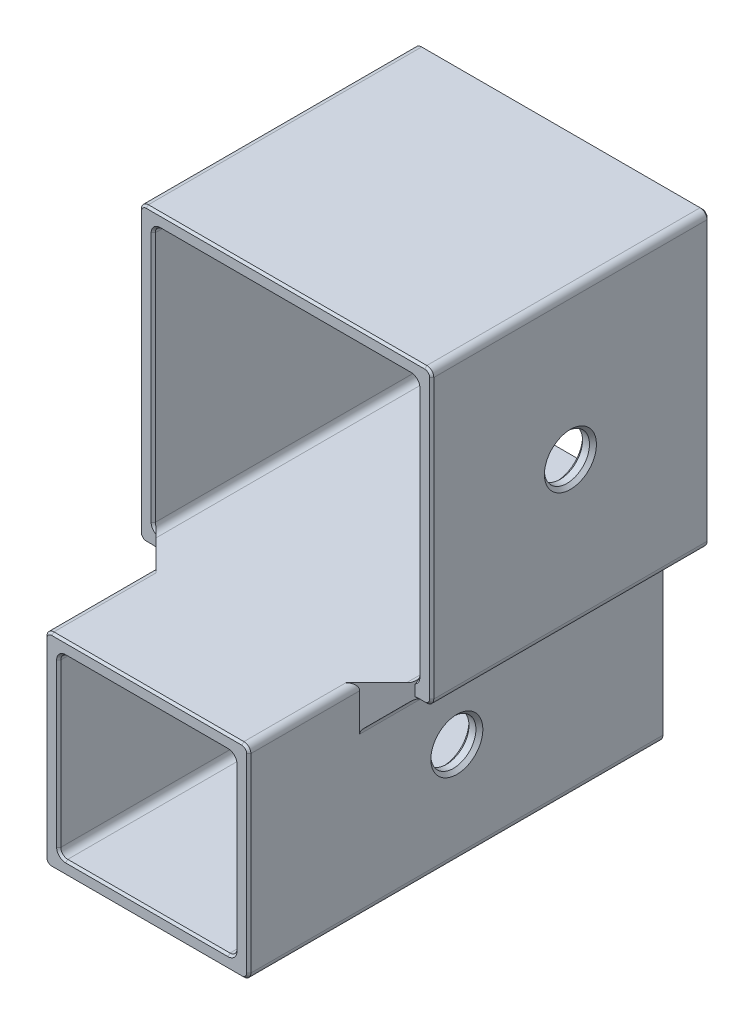
from build123d import *

# Parameters (mm, degrees)
SKETCH1_W           = 42.15
SKETCH1_H           = 42.15
SKETCH1_W_2         = 38.15
SKETCH1_H_2         = 38.15
BOSS_EXTRUDE1_DEPTH = 40
BOSS_EXTRUDE2_START = -40
SKETCH3_W           = 29.4
SKETCH3_H           = 29.4
SKETCH3_W_2         = 25.4
SKETCH3_H_2         = 25.4
BOSS_EXTRUDE2_DEPTH = 60
CHAMFER1_SIZE       = 4
FILLET1_R           = 1
CHAMFER2_SIZE       = 0.3
SKETCH6_R           = 3.25
CUT_EXTRUDE1_DEPTH  = 20
CHAMFER3_SIZE       = 0.5


with BuildPart() as part:
    # Sketch1 → Boss-Extrude1 (new body)
    with BuildSketch(Plane.XY):
        Rectangle(SKETCH1_W, SKETCH1_H)
        Rectangle(SKETCH1_W_2, SKETCH1_H_2, mode=Mode.SUBTRACT)
    extrude(amount=BOSS_EXTRUDE1_DEPTH)

    # Sketch3 → Boss-Extrude2 (add)
    with BuildSketch(Plane.XY.offset(40).offset(BOSS_EXTRUDE2_START)):
        with Locations((0, -33.775)):
            Rectangle(SKETCH3_W, SKETCH3_H)
        with Locations((0, -33.775)):
            Rectangle(SKETCH3_W_2, SKETCH3_H_2, mode=Mode.SUBTRACT)
    extrude(amount=BOSS_EXTRUDE2_DEPTH)

    # Chamfer1
    chamfer1_edges = [part.edges().sort_by_distance(p)[0] for p in [
        (-14.7, -21.075, 20),
        (-14.7, -20.075, 40),
        (14.7, -20.075, 40),
        (14.7, -21.075, 20),
    ]]
    chamfer(chamfer1_edges, length=CHAMFER1_SIZE)

    # Fillet1
    # the kernel refuses this fillet: 1 mm, written as the material it adds along each edge
    with BuildSketch(Plane(origin=(-18.7, -21.075, 41.035533906), x_dir=(-1, 0, 0), z_dir=(0, 0, -1))) as fillet1_piece_1_section:
        with BuildLine():
            CenterArc((FILLET1_R * 0.414213562373, -FILLET1_R), FILLET1_R, 90, 45)
            Line((-FILLET1_R * 0.292893218813, -FILLET1_R * 0.292893218813), (0, 0))
            Line((0, 0), (FILLET1_R * 0.414213562373, 0))
        make_face()
    fillet1_piece_1 = extrude(amount=41.035533906, mode=Mode.PRIVATE)
    fillet1_piece_1 = split(fillet1_piece_1, bisect_by=Plane(origin=(-18.52848767, -21.244019164, 40), z_dir=(0, 0, 1)), keep=Keep.TOP, mode=Mode.PRIVATE)
    fillet1_piece_1 = split(fillet1_piece_1, bisect_by=Plane(origin=(-18.571365753, -21.244019164, 40.128634247), z_dir=(0.7071067811865476, 0, -0.7071067811865476)), keep=Keep.TOP, mode=Mode.PRIVATE)
    add(fillet1_piece_1)
    with BuildSketch(Plane(origin=(-18.7, -21.075, 40), x_dir=(-1, 0, 0), z_dir=(0, 0, -1))) as fillet1_piece_2_section:
        with BuildLine():
            CenterArc((FILLET1_R * 0.414213562373, -FILLET1_R), FILLET1_R, 90, 45)
            Line((-FILLET1_R * 0.292893218813, -FILLET1_R * 0.292893218813), (0, 0))
            Line((0, 0), (FILLET1_R * 0.414213562373, 0))
        make_face()
    fillet1_piece_2 = extrude(amount=40, mode=Mode.PRIVATE)
    fillet1_piece_2 = split(fillet1_piece_2, bisect_by=Plane(origin=(-18.871940498, -21.07666124, 39.828059502), z_dir=(-0.7071067811865476, 0, 0.7071067811865476)), keep=Keep.TOP, mode=Mode.PRIVATE)
    add(fillet1_piece_2)
    with BuildSketch(Plane(origin=(-18.7, -21.075, 40), x_dir=(-1, 0, 0), z_dir=(0, 0, -1))) as fillet1_piece_3_section:
        with BuildLine():
            CenterArc((FILLET1_R * 0.414213562373, -FILLET1_R), FILLET1_R, 90, 45)
            Line((-FILLET1_R * 0.292893218813, -FILLET1_R * 0.292893218813), (0, 0))
            Line((0, 0), (FILLET1_R * 0.414213562373, 0))
        make_face()
    fillet1_piece_3 = extrude(amount=40, mode=Mode.PRIVATE)
    fillet1_piece_3 = split(fillet1_piece_3, bisect_by=Plane(origin=(-28.731905548, -21.13692691, 29.968094452), z_dir=(0.7071067811865476, 0, -0.7071067811865476)), keep=Keep.TOP, mode=Mode.PRIVATE)
    add(fillet1_piece_3)
    with BuildSketch(Plane(origin=(-14.7, -25.075, 45.035533906), x_dir=(-0.7071067811865476, 0.7071067811865476, 0), z_dir=(0, 0, -1))) as fillet1_piece_4_section:
        with BuildLine():
            CenterArc((FILLET1_R * 0.414213562373, -FILLET1_R), FILLET1_R, 90, 45)
            Line((-FILLET1_R * 0.292893218813, -FILLET1_R * 0.292893218813), (0, 0))
            Line((0, 0), (FILLET1_R * 0.414213562373, 0))
        make_face()
    fillet1_piece_4 = extrude(amount=45.035533906, mode=Mode.PRIVATE)
    fillet1_piece_4 = split(fillet1_piece_4, bisect_by=Plane(origin=(-25.746262665, -25.100835331, 32.953737335), z_dir=(0.7071067811865476, 0, -0.7071067811865476)), keep=Keep.TOP, mode=Mode.PRIVATE)
    add(fillet1_piece_4)
    with BuildSketch(Plane(origin=(14.7, -25.075, 0), x_dir=(0, -1, 0), z_dir=(0, 0, 1))) as fillet1_piece_5_section:
        with BuildLine():
            CenterArc((FILLET1_R * 0.414213562373, FILLET1_R), FILLET1_R, 225, 45)
            Line((-FILLET1_R * 0.292893218813, FILLET1_R * 0.292893218813), (0, 0))
            Line((0, 0), (FILLET1_R * 0.414213562373, 0))
        make_face()
    fillet1_piece_5 = extrude(amount=45.035533906, mode=Mode.PRIVATE)
    fillet1_piece_5 = split(fillet1_piece_5, bisect_by=Plane(origin=(25.746262665, -25.100835331, 32.953737335), z_dir=(-0.7071067811865476, 0, -0.7071067811865476)), keep=Keep.TOP, mode=Mode.PRIVATE)
    add(fillet1_piece_5)
    with BuildSketch(Plane(origin=(18.7, -21.075, 0), x_dir=(1, 0, 0), z_dir=(0, 0, 1))) as fillet1_piece_6_section:
        with BuildLine():
            CenterArc((FILLET1_R * 0.414213562373, -FILLET1_R), FILLET1_R, 90, 45)
            Line((-FILLET1_R * 0.292893218813, -FILLET1_R * 0.292893218813), (0, 0))
            Line((0, 0), (FILLET1_R * 0.414213562373, 0))
        make_face()
    fillet1_piece_6 = extrude(amount=40, mode=Mode.PRIVATE)
    fillet1_piece_6 = split(fillet1_piece_6, bisect_by=Plane(origin=(28.731905548, -21.13692691, 29.968094452), z_dir=(-0.7071067811865476, 0, -0.7071067811865476)), keep=Keep.TOP, mode=Mode.PRIVATE)
    add(fillet1_piece_6)
    with BuildSketch(Plane(origin=(18.7, -21.075, 0), x_dir=(1, 0, 0), z_dir=(0, 0, 1))) as fillet1_piece_7_section:
        with BuildLine():
            CenterArc((FILLET1_R * 0.414213562373, -FILLET1_R), FILLET1_R, 90, 45)
            Line((-FILLET1_R * 0.292893218813, -FILLET1_R * 0.292893218813), (0, 0))
            Line((0, 0), (FILLET1_R * 0.414213562373, 0))
        make_face()
    fillet1_piece_7 = extrude(amount=41.035533906, mode=Mode.PRIVATE)
    fillet1_piece_7 = split(fillet1_piece_7, bisect_by=Plane(origin=(18.52848767, -21.244019164, 40), z_dir=(0, 0, 1)), keep=Keep.TOP, mode=Mode.PRIVATE)
    fillet1_piece_7 = split(fillet1_piece_7, bisect_by=Plane(origin=(18.571365753, -21.244019164, 40.128634247), z_dir=(-0.7071067811865476, 0, -0.7071067811865476)), keep=Keep.TOP, mode=Mode.PRIVATE)
    add(fillet1_piece_7)
    with BuildSketch(Plane(origin=(18.7, -21.075, 0), x_dir=(1, 0, 0), z_dir=(0, 0, 1))) as fillet1_piece_8_section:
        with BuildLine():
            CenterArc((FILLET1_R * 0.414213562373, -FILLET1_R), FILLET1_R, 90, 45)
            Line((-FILLET1_R * 0.292893218813, -FILLET1_R * 0.292893218813), (0, 0))
            Line((0, 0), (FILLET1_R * 0.414213562373, 0))
        make_face()
    fillet1_piece_8 = extrude(amount=40, mode=Mode.PRIVATE)
    fillet1_piece_8 = split(fillet1_piece_8, bisect_by=Plane(origin=(18.871940498, -21.07666124, 39.828059502), z_dir=(0.7071067811865476, 0, 0.7071067811865476)), keep=Keep.TOP, mode=Mode.PRIVATE)
    add(fillet1_piece_8)
    with BuildSketch(Plane(origin=(12.7, -46.475, 0), x_dir=(-1, 0, 0), z_dir=(0, 0, 1)), Plane(origin=(-12.7, -46.475, 0), x_dir=(0, 1, 0), z_dir=(0, 0, 1))) as fillet1_piece_9:
        with BuildLine():
            CenterArc((FILLET1_R, -FILLET1_R), FILLET1_R, 90, 90)
            Line((0, -FILLET1_R), (0, 0))
            Line((0, 0), (FILLET1_R, 0))
        make_face()
    extrude(amount=60)
    with BuildSketch(Plane(origin=(12.7, -21.075, 0), x_dir=(-1, 0, 0), z_dir=(0, 0, 1)), Plane(origin=(-12.7, -21.075, 60), x_dir=(1, 0, 0), z_dir=(0, 0, -1))) as fillet1_piece_10:
        with BuildLine():
            CenterArc((FILLET1_R, FILLET1_R), FILLET1_R, 180, 90)
            Line((0, FILLET1_R), (0, 0))
            Line((0, 0), (FILLET1_R, 0))
        make_face()
    extrude(amount=60)
    with BuildSketch(Plane(origin=(-19.075, -19.075, 0), x_dir=(1, 0, 0), z_dir=(0, 0, 1))) as fillet1_piece_11_section:
        with BuildLine():
            CenterArc((FILLET1_R, FILLET1_R), FILLET1_R, 180, 90)
            Line((0, FILLET1_R), (0, 0))
            Line((0, 0), (FILLET1_R, 0))
        make_face()
    fillet1_piece_11 = extrude(amount=40, mode=Mode.PRIVATE)
    fillet1_piece_11 = split(fillet1_piece_11, bisect_by=Plane(origin=(-28.821320902, -18.849083106, 29.878679098), z_dir=(0.7071067811865476, 0, -0.7071067811865476)), keep=Keep.TOP, mode=Mode.PRIVATE)
    add(fillet1_piece_11)
    with BuildSketch(Plane(origin=(-19.075, -19.075, 0), x_dir=(1, 0, 0), z_dir=(0, 0, 1))) as fillet1_piece_12_section:
        with BuildLine():
            CenterArc((FILLET1_R, FILLET1_R), FILLET1_R, 180, 90)
            Line((0, FILLET1_R), (0, 0))
            Line((0, 0), (FILLET1_R, 0))
        make_face()
    fillet1_piece_12 = extrude(amount=40, mode=Mode.PRIVATE)
    fillet1_piece_12 = split(fillet1_piece_12, bisect_by=Plane(origin=(-18.920138654, -18.748379017, 39.779861346), z_dir=(-0.7071067811865476, 0, 0.7071067811865476)), keep=Keep.TOP, mode=Mode.PRIVATE)
    add(fillet1_piece_12)
    with BuildSketch(Plane(origin=(-19.075, -19.075, 0), x_dir=(1, 0, 0), z_dir=(0, 0, 1))) as fillet1_piece_13_section:
        with BuildLine():
            CenterArc((FILLET1_R, FILLET1_R), FILLET1_R, 180, 90)
            Line((0, FILLET1_R), (0, 0))
            Line((0, 0), (FILLET1_R, 0))
        make_face()
    fillet1_piece_13 = extrude(amount=42.5, mode=Mode.PRIVATE)
    fillet1_piece_13 = split(fillet1_piece_13, bisect_by=Plane(origin=(-18.390272187, -19.052221158, 40), z_dir=(0, 0, 1)), keep=Keep.TOP, mode=Mode.PRIVATE)
    fillet1_piece_13 = split(fillet1_piece_13, bisect_by=Plane(origin=(-18.467704141, -19.052221158, 40.232295859), z_dir=(0.7071067811865476, 0, -0.7071067811865476)), keep=Keep.TOP, mode=Mode.PRIVATE)
    add(fillet1_piece_13)
    with BuildSketch(Plane(origin=(-19.075, 19.075, 0), x_dir=(0, -1, 0), z_dir=(0, 0, 1)), Plane(origin=(19.075, 19.075, 0), x_dir=(-1, 0, 0), z_dir=(0, 0, 1))) as fillet1_piece_14:
        with BuildLine():
            CenterArc((FILLET1_R, FILLET1_R), FILLET1_R, 180, 90)
            Line((0, FILLET1_R), (0, 0))
            Line((0, 0), (FILLET1_R, 0))
        make_face()
    extrude(amount=40)
    with BuildSketch(Plane(origin=(19.075, -19.075, 0), x_dir=(-1, 0, 0), z_dir=(0, 0, 1))) as fillet1_piece_15_section:
        with BuildLine():
            CenterArc((FILLET1_R, -FILLET1_R), FILLET1_R, 90, 90)
            Line((0, -FILLET1_R), (0, 0))
            Line((0, 0), (FILLET1_R, 0))
        make_face()
    fillet1_piece_15 = extrude(amount=40, mode=Mode.PRIVATE)
    fillet1_piece_15 = split(fillet1_piece_15, bisect_by=Plane(origin=(28.821320902, -18.849083106, 29.878679098), z_dir=(-0.7071067811865476, 0, -0.7071067811865476)), keep=Keep.TOP, mode=Mode.PRIVATE)
    add(fillet1_piece_15)
    with BuildSketch(Plane(origin=(19.075, -19.075, 0), x_dir=(-1, 0, 0), z_dir=(0, 0, 1))) as fillet1_piece_16_section:
        with BuildLine():
            CenterArc((FILLET1_R, -FILLET1_R), FILLET1_R, 90, 90)
            Line((0, -FILLET1_R), (0, 0))
            Line((0, 0), (FILLET1_R, 0))
        make_face()
    fillet1_piece_16 = extrude(amount=40, mode=Mode.PRIVATE)
    fillet1_piece_16 = split(fillet1_piece_16, bisect_by=Plane(origin=(18.920138654, -18.748379017, 39.779861346), z_dir=(0.7071067811865476, 0, 0.7071067811865476)), keep=Keep.TOP, mode=Mode.PRIVATE)
    add(fillet1_piece_16)
    with BuildSketch(Plane(origin=(19.075, -19.075, 0), x_dir=(-1, 0, 0), z_dir=(0, 0, 1))) as fillet1_piece_17_section:
        with BuildLine():
            CenterArc((FILLET1_R, -FILLET1_R), FILLET1_R, 90, 90)
            Line((0, -FILLET1_R), (0, 0))
            Line((0, 0), (FILLET1_R, 0))
        make_face()
    fillet1_piece_17 = extrude(amount=42.5, mode=Mode.PRIVATE)
    fillet1_piece_17 = split(fillet1_piece_17, bisect_by=Plane(origin=(18.390272187, -19.052221158, 40), z_dir=(0, 0, 1)), keep=Keep.TOP, mode=Mode.PRIVATE)
    fillet1_piece_17 = split(fillet1_piece_17, bisect_by=Plane(origin=(18.467704141, -19.052221158, 40.232295859), z_dir=(-0.7071067811865476, 0, -0.7071067811865476)), keep=Keep.TOP, mode=Mode.PRIVATE)
    add(fillet1_piece_17)
    # the kernel refuses this fillet: 1 mm, written as the material it takes off along each edge
    with BuildSketch(Plane(origin=(14.7, -48.475, -2.5), x_dir=(0, 1, 0), z_dir=(0, 0, 1))) as fillet1_2_piece_1:
        with BuildLine():
            CenterArc((FILLET1_R, FILLET1_R), FILLET1_R, 180, 90)
            Line((0, FILLET1_R), (0, 0))
            Line((0, 0), (FILLET1_R, 0))
        make_face()
    extrude(amount=65, mode=Mode.SUBTRACT)
    with BuildSketch(Plane(origin=(-14.7, -48.475, -2.5), x_dir=(0, 1, 0), z_dir=(0, 0, 1))) as fillet1_2_piece_2:
        with BuildLine():
            CenterArc((FILLET1_R, -FILLET1_R), FILLET1_R, 90, 90)
            Line((0, -FILLET1_R), (0, 0))
            Line((0, 0), (FILLET1_R, 0))
        make_face()
    extrude(amount=65, mode=Mode.SUBTRACT)
    with BuildSketch(Plane(origin=(-21.075, -21.075, -2.5), x_dir=(0, 1, 0), z_dir=(0, 0, 1)), Plane(origin=(21.075, -21.075, -2.5), x_dir=(-1, 0, 0), z_dir=(0, 0, 1)), Plane(origin=(21.075, 21.075, -2.5), x_dir=(0, -1, 0), z_dir=(0, 0, 1)), Plane(origin=(-21.075, 21.075, -2.5), x_dir=(1, 0, 0), z_dir=(0, 0, 1))) as fillet1_2_piece_3:
        with BuildLine():
            CenterArc((FILLET1_R, -FILLET1_R), FILLET1_R, 90, 90)
            Line((0, -FILLET1_R), (0, 0))
            Line((0, 0), (FILLET1_R, 0))
        make_face()
    extrude(amount=45, mode=Mode.SUBTRACT)
    with BuildSketch(Plane(origin=(14.7, -19.075, 41.5), x_dir=(-1, 0, 0), z_dir=(0, 0, 1))) as fillet1_2_piece_4_section:
        with BuildLine():
            CenterArc((FILLET1_R, FILLET1_R), FILLET1_R, 180, 90)
            Line((0, FILLET1_R), (0, 0))
            Line((0, 0), (FILLET1_R, 0))
        make_face()
    fillet1_2_piece_4 = extrude(amount=21, mode=Mode.PRIVATE)
    fillet1_2_piece_4 = split(fillet1_2_piece_4, bisect_by=Plane(origin=(9.907111196, -19.302897648, 48.792888804), z_dir=(0.7071067811865476, 0, 0.7071067811865476)), keep=Keep.TOP, mode=Mode.PRIVATE)
    add(fillet1_2_piece_4, mode=Mode.SUBTRACT)
    with BuildSketch(Plane(origin=(-14.7, -19.075, 41.5), x_dir=(0, -1, 0), z_dir=(0, 0, 1))) as fillet1_2_piece_5_section:
        with BuildLine():
            CenterArc((FILLET1_R, FILLET1_R), FILLET1_R, 180, 90)
            Line((0, FILLET1_R), (0, 0))
            Line((0, 0), (FILLET1_R, 0))
        make_face()
    fillet1_2_piece_5 = extrude(amount=21, mode=Mode.PRIVATE)
    fillet1_2_piece_5 = split(fillet1_2_piece_5, bisect_by=Plane(origin=(-9.907111196, -19.302897648, 48.792888804), z_dir=(-0.7071067811865476, 0, 0.7071067811865476)), keep=Keep.TOP, mode=Mode.PRIVATE)
    add(fillet1_2_piece_5, mode=Mode.SUBTRACT)

    # Chamfer2
    chamfer2_edges = [part.edges().sort_by_distance(p)[0] for p in [
        (-19.594606781, -21.075, 40),
        (-16.7, -23.075, 0),
        (16.7, -23.075, 0),
        (19.594606781, -21.075, 40),
        (19.594606781, -21.075, 0),
        (0, -48.475, 0),
        (19.075, 0, 0),
        (0, 19.075, 0),
        (-19.075, 0, 0),
        (-21.075, 0, 0),
        (0, 21.075, 0),
        (21.075, 0, 0),
        (12.7, -33.775, 0),
        (0, -21.075, 0),
        (-12.7, -33.775, 0),
        (0, -46.475, 0),
        (-20.782106781, 20.782106781, 0),
        (20.782106781, 20.782106781, 0),
        (20.782106781, -20.782106781, 0),
        (-20.782106781, -20.782106781, 0),
        (-14.407106781, -48.182106781, 0),
        (14.407106781, -48.182106781, 0),
        (-21.075, 0, 40),
        (21.075, 0, 40),
        (0, 21.075, 40),
        (-19.075, 0, 40),
        (0, 19.075, 40),
        (19.075, 0, 40),
        (-20.782106781, 20.782106781, 40),
        (20.782106781, 20.782106781, 40),
        (20.782106781, -20.782106781, 40),
        (-20.782106781, -20.782106781, 40),
        (-18.902293437, -21.09771301, 40),
        (-18.73153013, -21.151120467, 0),
        (-14.776120467, -25.10653013, 0),
        (14.776120467, -25.10653013, 0),
        (18.73153013, -21.151120467, 0),
        (18.902293437, -21.09771301, 40),
        (12.407106781, -46.182106781, 60),
        (12.407106781, -46.182106781, 0),
        (12.407106781, -21.367893219, 60),
        (12.407106781, -21.367893219, 0),
        (-12.407106781, -21.367893219, 60),
        (-12.407106781, -21.367893219, 0),
        (-12.407106781, -46.182106781, 60),
        (-12.407106781, -46.182106781, 0),
        (-18.782106781, -18.782106781, 0),
        (-18.976387819, -18.508012702, 40),
        (-18.782106781, 18.782106781, 0),
        (-18.782106781, 18.782106781, 40),
        (18.782106781, 18.782106781, 0),
        (18.782106781, 18.782106781, 40),
        (18.782106781, -18.782106781, 0),
        (18.976387819, -18.508012702, 40),
        (14.7, -36.482106781, 0),
        (14.7, -33.775, 60),
        (0, -48.475, 60),
        (0, -19.075, 60),
        (-14.7, -33.775, 60),
        (-12.7, -33.775, 60),
        (0, -21.075, 60),
        (12.7, -33.775, 60),
        (0, -46.475, 60),
        (-14.407106781, -48.182106781, 60),
        (14.407106781, -48.182106781, 60),
        (-14.407106781, -19.367893219, 60),
        (14.407106781, -19.367893219, 60),
        (0, -19.075, 0),
        (-14.7, -36.482106781, 0),
        (-19.594606781, -21.075, 0),
    ]]
    chamfer(chamfer2_edges, length=CHAMFER2_SIZE)

    # Sketch6 → Cut-Extrude1 (cut)
    with BuildSketch(Plane(origin=(21.075, 0, 0), x_dir=(0, 0, -1), z_dir=(1, 0, 0))):
        with Locations((-20, 0)):
            Circle(SKETCH6_R)
        with Locations((-30, -33.775)):
            Circle(SKETCH6_R)
    extrude(amount=-CUT_EXTRUDE1_DEPTH, mode=Mode.SUBTRACT)

    # Chamfer3
    chamfer3_edges = [part.edges().sort_by_distance(p)[0] for p in [
        (19.075, 0, 23.25),
        (21.075, 0, 23.25),
        (14.7, -33.775, 33.25),
        (12.7, -33.775, 33.25),
    ]]
    chamfer(chamfer3_edges, length=CHAMFER3_SIZE)


solid = part.part
